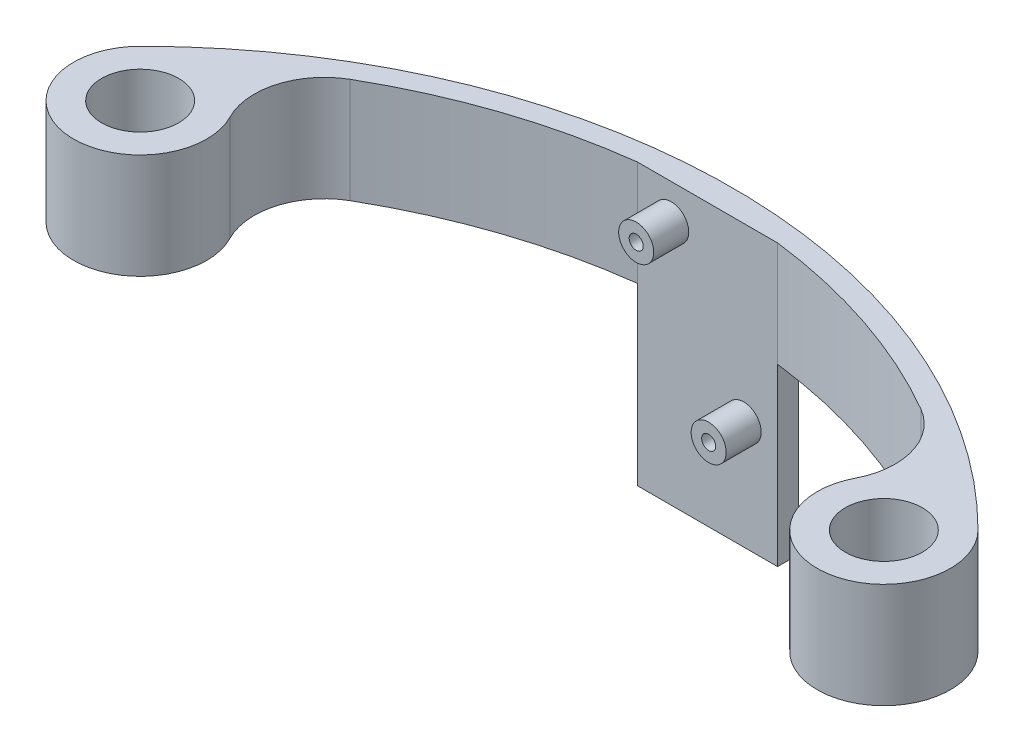
from build123d import *

# Parameters (mm, degrees)
SKETCH1_W           = 20
SKETCH1_H           = 40
SKETCH1_R           = 2.5
SKETCH1_R_2         = 1
BOSS_EXTRUDE1_DEPTH = 3
SKETCH2_R           = 2.5
SKETCH2_R_2         = 1
BOSS_EXTRUDE2_DEPTH = 5
SKETCH3_R           = 5.5
BOSS_EXTRUDE3_DEPTH = 15


with BuildPart() as part:
    # Sketch1 → Boss-Extrude1 (new body)
    # profile 1 of 5: a face of its own
    with BuildSketch(Plane.XY):
        with Locations((10, -20)):
            Rectangle(SKETCH1_W, SKETCH1_H)
        with Locations((15.1678, -24.558)):
            Circle(SKETCH1_R, mode=Mode.SUBTRACT)
        with Locations((4.83, -5)):
            Circle(SKETCH1_R, mode=Mode.SUBTRACT)
    # profile 2 of 5: a face of its own
    with BuildSketch(Plane.XY):
        with Locations((4.83, -5)):
            Circle(SKETCH1_R)
        with Locations((4.83, -5)):
            Circle(SKETCH1_R_2, mode=Mode.SUBTRACT)
    # profile 3 of 5: a face of its own
    with BuildSketch(Plane.XY):
        with Locations((4.83, -5)):
            Circle(SKETCH1_R_2)
    # profile 4 of 5: a face of its own
    with BuildSketch(Plane.XY):
        with Locations((15.1678, -24.558)):
            Circle(SKETCH1_R)
        with Locations((15.1678, -24.558)):
            Circle(SKETCH1_R_2, mode=Mode.SUBTRACT)
    # profile 5 of 5: a face of its own
    with BuildSketch(Plane.XY):
        with Locations((15.1678, -24.558)):
            Circle(SKETCH1_R_2)
    extrude(amount=BOSS_EXTRUDE1_DEPTH)

    # Sketch2 → Boss-Extrude2 (add)
    # profile 1 of 2: a face of its own
    with BuildSketch(Plane.XY.offset(3)):
        with Locations((15.1678, -24.558)):
            Circle(SKETCH2_R)
        with Locations((15.1678, -24.558)):
            Circle(SKETCH2_R_2, mode=Mode.SUBTRACT)
    # profile 2 of 2: a face of its own
    with BuildSketch(Plane.XY.offset(3)):
        with Locations((4.83, -5)):
            Circle(SKETCH2_R)
        with Locations((4.83, -5)):
            Circle(SKETCH2_R_2, mode=Mode.SUBTRACT)
    extrude(amount=BOSS_EXTRUDE2_DEPTH)

    # Sketch3 → Boss-Extrude3 (add)
    # profile 1 of 3: a face of its own
    with BuildSketch(Plane(origin=(0, 0, 0), x_dir=(1, 0, 0), z_dir=(0, 1, 0))):
        with BuildLine():
            Line((0, 0), (20, 0))
            ThreePointArc((20, 0), (10, 0.593802374), (0, 0))
        make_face()
    # profile 2 of 3: a face of its own
    with BuildSketch(Plane(origin=(0, 0, 0), x_dir=(1, 0, 0), z_dir=(0, 1, 0))):
        with BuildLine():
            ThreePointArc((69.769666667, -24.174824407), (46.919603607, -7.898350205), (20, 0))
            Line((20, 0), (20, -3))
            ThreePointArc((20, -3), (35.874630461, -6.599559407), (50.717669917, -13.28124332))
            ThreePointArc((50.717669917, -13.28124332), (55.317872875, -19.127120719), (54.608629413, -26.532059851))
            ThreePointArc((54.608629413, -26.532059851), (64.509522467, -40.277400292), (69.769666667, -24.174824407))
        make_face()
        with Locations((63.05, -30.890185893)):
            Circle(SKETCH3_R, mode=Mode.SUBTRACT)
    # profile 3 of 3: a face of its own
    with BuildSketch(Plane(origin=(0, 0, 0), x_dir=(1, 0, 0), z_dir=(0, 1, 0))):
        with BuildLine():
            Line((0, -3), (0, 0))
            ThreePointArc((0, 0), (-26.919603607, -7.898350205), (-49.769666667, -24.174824407))
            ThreePointArc((-49.769666667, -24.174824407), (-44.509522467, -40.277400292), (-34.608629413, -26.532059851))
            ThreePointArc((-34.608629413, -26.532059851), (-35.317872875, -19.127120719), (-30.717669917, -13.28124332))
            ThreePointArc((-30.717669917, -13.28124332), (-15.874630461, -6.599559407), (0, -3))
        make_face()
        with Locations((-43.05, -30.890185893)):
            Circle(SKETCH3_R, mode=Mode.SUBTRACT)
    extrude(amount=-BOSS_EXTRUDE3_DEPTH)


solid = part.part
